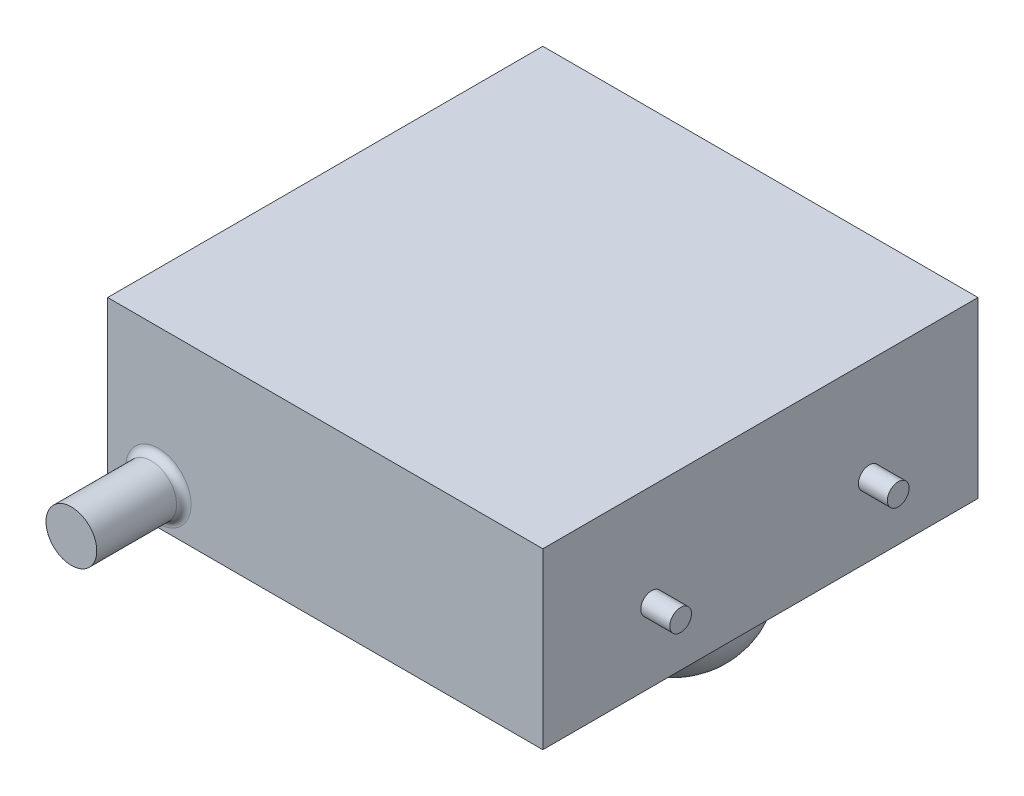
from build123d import *

# Parameters (mm, degrees)
SKETCH1_W           = 300
SKETCH1_H           = 300
BOSS_EXTRUDE1_DEPTH = 120
SKETCH3_R           = 17.5
BOSS_EXTRUDE3_DEPTH = 60
FILLET1_R           = 5
SKETCH4_R           = 51
BOSS_EXTRUDE4_DEPTH = 50
FILLET2_R           = 50
SKETCH6_R           = 7.5
BOSS_EXTRUDE5_DEPTH = 20


with BuildPart() as part:
    # Sketch1 → Boss-Extrude1 (new body)
    with BuildSketch(Plane(origin=(0, 0, 0), x_dir=(1, 0, 0), z_dir=(0, 1, 0))):
        Rectangle(SKETCH1_W, SKETCH1_H)
    extrude(amount=BOSS_EXTRUDE1_DEPTH)

    # Sketch3 → Boss-Extrude3 (add)
    with BuildSketch(Plane.XY.offset(150)):
        with Locations(Location((-115, 25, 0), (0, 0, 180))):
            Circle(SKETCH3_R)
    boss_extrude3 = extrude(amount=BOSS_EXTRUDE3_DEPTH)

    # Mirror1: Boss-Extrude3 across plane
    add(boss_extrude3.mirror(Plane.XY))

    # Fillet1
    fillet1_edges = [part.edges().sort_by_distance(p)[0] for p in [
        (-97.5, 25, 150),
        (-97.5, 25, -150),
    ]]
    fillet(fillet1_edges, radius=FILLET1_R)

    # Sketch4 → Boss-Extrude4 (add)
    with BuildSketch(Plane.XZ):
        with Locations(Location((90, 0, 0), (0, 0, 90))):
            Circle(SKETCH4_R)
    extrude(amount=BOSS_EXTRUDE4_DEPTH)

    # Fillet2
    fillet2_edges = [part.edges().sort_by_distance(p)[0] for p in [
        (90, -50, -51),
    ]]
    fillet(fillet2_edges, radius=FILLET2_R - 0.0001)  # a hair under: the kernel refuses the full size

    # Sketch6 → Boss-Extrude5 (add)
    with BuildSketch(Plane(origin=(150, 0, 0), x_dir=(0, 0, -1), z_dir=(1, 0, 0))):
        with Locations(Location((-75, 50, 0), (0, 0, 180))):
            Circle(SKETCH6_R)
        with Locations(Location((75, 50, 0), (0, 0, 180))):
            Circle(SKETCH6_R)
    extrude(amount=BOSS_EXTRUDE5_DEPTH)


solid = part.part
